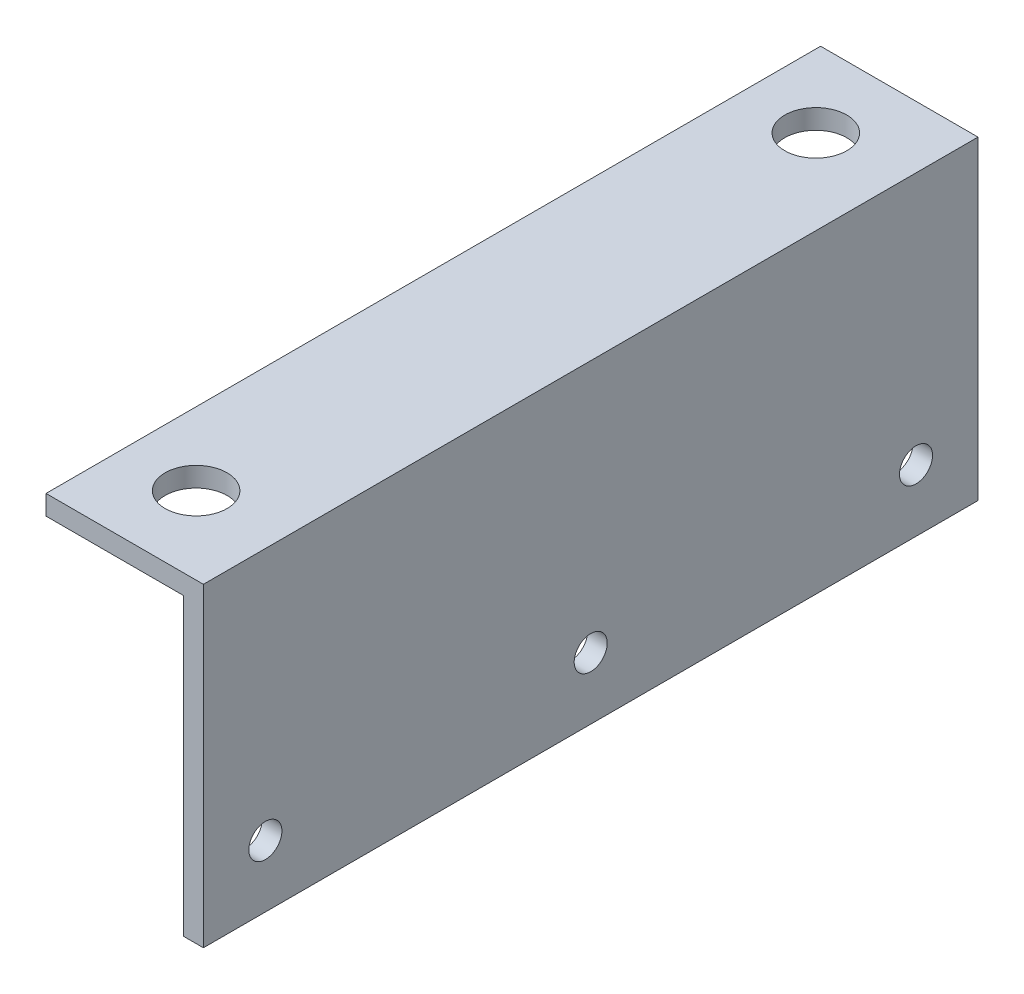
from build123d import *

# Parameters (mm, degrees)
BOSS_EXTRUDE1_DEPTH = 125
CUT_EXTRUDE1_REACH  = 139.298
SKETCH2_R           = 2.665
CUT_EXTRUDE2_REACH  = 139.298
SKETCH3_R           = 5


with BuildPart() as part:
    # Sketch1 → Boss-Extrude1 (new body)
    with BuildSketch(Plane.XY):
        Polygon((0, 0), (0, 50.8), (-25.4, 50.8), (-25.4, 47.625), (-3.175, 47.625), (-3.175, 0), align=None)
    extrude(amount=BOSS_EXTRUDE1_DEPTH)

    # Sketch2 → Cut-Extrude1 (cut, up to next)
    with BuildSketch(Plane(origin=(0, 0, 0), x_dir=(0, 0, -1), z_dir=(1, 0, 0)), mode=Mode.PRIVATE) as cut_extrude1_sk1:
        with Locations((-115, 10)):
            Circle(SKETCH2_R)
    cut_extrude1_tool1 = extrude(cut_extrude1_sk1.sketch, amount=-CUT_EXTRUDE1_REACH, mode=Mode.PRIVATE) & part.part
    # Sketch2 → Cut-Extrude1 (cut, up to next)
    with BuildSketch(Plane(origin=(0, 0, 0), x_dir=(0, 0, -1), z_dir=(1, 0, 0)), mode=Mode.PRIVATE) as cut_extrude1_sk2:
        with Locations((-10, 10)):
            Circle(SKETCH2_R)
    cut_extrude1_tool2 = extrude(cut_extrude1_sk2.sketch, amount=-CUT_EXTRUDE1_REACH, mode=Mode.PRIVATE) & part.part
    # Sketch2 → Cut-Extrude1 (cut, up to next)
    with BuildSketch(Plane(origin=(0, 0, 0), x_dir=(0, 0, -1), z_dir=(1, 0, 0)), mode=Mode.PRIVATE) as cut_extrude1_sk3:
        with Locations((-62.5, 10)):
            Circle(SKETCH2_R)
    cut_extrude1_tool3 = extrude(cut_extrude1_sk3.sketch, amount=-CUT_EXTRUDE1_REACH, mode=Mode.PRIVATE) & part.part
    add(cut_extrude1_tool1.solids().sort_by_distance((0, 10, 115))[0], mode=Mode.SUBTRACT)
    add(cut_extrude1_tool2.solids().sort_by_distance((0, 10, 10))[0], mode=Mode.SUBTRACT)
    add(cut_extrude1_tool3.solids().sort_by_distance((0, 10, 62.5))[0], mode=Mode.SUBTRACT)

    # Sketch3 → Cut-Extrude2 (cut, up to next)
    with BuildSketch(Plane(origin=(0, 50.8, 0), x_dir=(1, 0, 0), z_dir=(0, 1, 0)), mode=Mode.PRIVATE) as cut_extrude2_sk1:
        with Locations((-13.675, -12.5)):
            Circle(SKETCH3_R)
    cut_extrude2_tool1 = extrude(cut_extrude2_sk1.sketch, amount=-CUT_EXTRUDE2_REACH, mode=Mode.PRIVATE) & part.part
    # Sketch3 → Cut-Extrude2 (cut, up to next)
    with BuildSketch(Plane(origin=(0, 50.8, 0), x_dir=(1, 0, 0), z_dir=(0, 1, 0)), mode=Mode.PRIVATE) as cut_extrude2_sk2:
        with Locations((-13.675, -112.5)):
            Circle(SKETCH3_R)
    cut_extrude2_tool2 = extrude(cut_extrude2_sk2.sketch, amount=-CUT_EXTRUDE2_REACH, mode=Mode.PRIVATE) & part.part
    add(cut_extrude2_tool1.solids().sort_by_distance((-13.675, 50.8, 12.5))[0], mode=Mode.SUBTRACT)
    add(cut_extrude2_tool2.solids().sort_by_distance((-13.675, 50.8, 112.5))[0], mode=Mode.SUBTRACT)


solid = part.part
